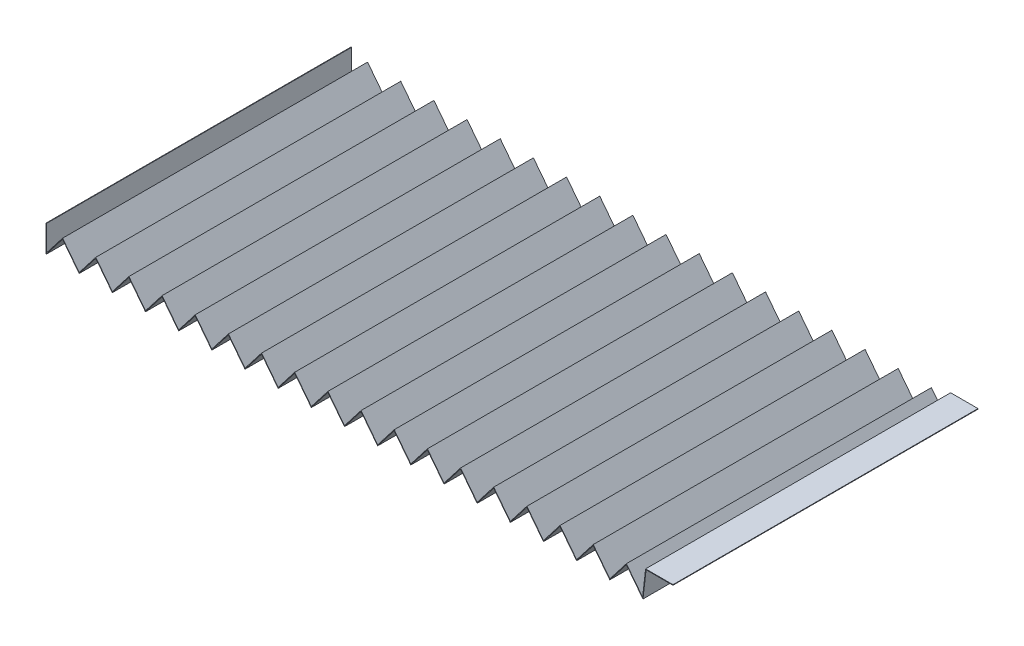
from build123d import *

# Parameters (mm, degrees)
EXTRUDE_THIN1_DEPTH = 85


with BuildPart() as part:
    # Sketch1 → Extrude-Thin1 (new, symmetric)
    with BuildSketch(Plane.XY):
        Polygon((0, 15.1), (0, 0), (9.242449513, 11.940985177), (18.484899026, 0), (27.727348538, 11.940985177), (36.969798051, 0), (46.212247564, 11.940985177), (55.454697077, 0), (64.697146589, 11.940985177), (73.939596102, 0), (83.182045615, 11.940985177), (92.424495128, 0), (101.66694464, 11.940985177), (110.909394153, 0), (120.151843666, 11.940985177), (129.394293179, 0), (138.636742691, 11.940985177), (147.879192204, 0), (157.121641717, 11.940985177), (166.36409123, 0), (175.606540742, 11.940985177), (184.848990255, 0), (194.091439768, 11.940985177), (203.333889281, 0), (212.576338793, 11.940985177), (221.818788306, 0), (231.061237819, 11.940985177), (240.303687332, 0), (249.546136844, 11.940985177), (258.788586357, 0), (268.03103587, 11.940985177), (277.273485383, 0), (286.515934895, 11.940985177), (295.758384408, 0), (305.000833921, 11.940985177), (314.243283434, 0), (323.485732946, 11.940985177), (332.728182459, 0), (334.463117616, 15), (349.463117616, 15), (349.463117616, 15.3), (334.19581632, 15.3), (332.514763718, 0.765860827), (323.485732946, 12.431114985), (314.243283434, 0.490129807), (305.000833921, 12.431114985), (295.758384408, 0.490129807), (286.515934895, 12.431114985), (277.273485383, 0.490129807), (268.03103587, 12.431114985), (258.788586357, 0.490129807), (249.546136844, 12.431114985), (240.303687332, 0.490129807), (231.061237819, 12.431114985), (221.818788306, 0.490129807), (212.576338793, 12.431114985), (203.333889281, 0.490129807), (194.091439768, 12.431114985), (184.848990255, 0.490129807), (175.606540742, 12.431114985), (166.36409123, 0.490129807), (157.121641717, 12.431114985), (147.879192204, 0.490129807), (138.636742691, 12.431114985), (129.394293179, 0.490129807), (120.151843666, 12.431114985), (110.909394153, 0.490129807), (101.66694464, 12.431114985), (92.424495128, 0.490129807), (83.182045615, 12.431114985), (73.939596102, 0.490129807), (64.697146589, 12.431114985), (55.454697077, 0.490129807), (46.212247564, 12.431114985), (36.969798051, 0.490129807), (27.727348538, 12.431114985), (18.484899026, 0.490129807), (9.242449513, 12.431114985), (0.3, 0.877721381), (0.3, 15.1), align=None)
    extrude(amount=EXTRUDE_THIN1_DEPTH, both=True)


solid = part.part
